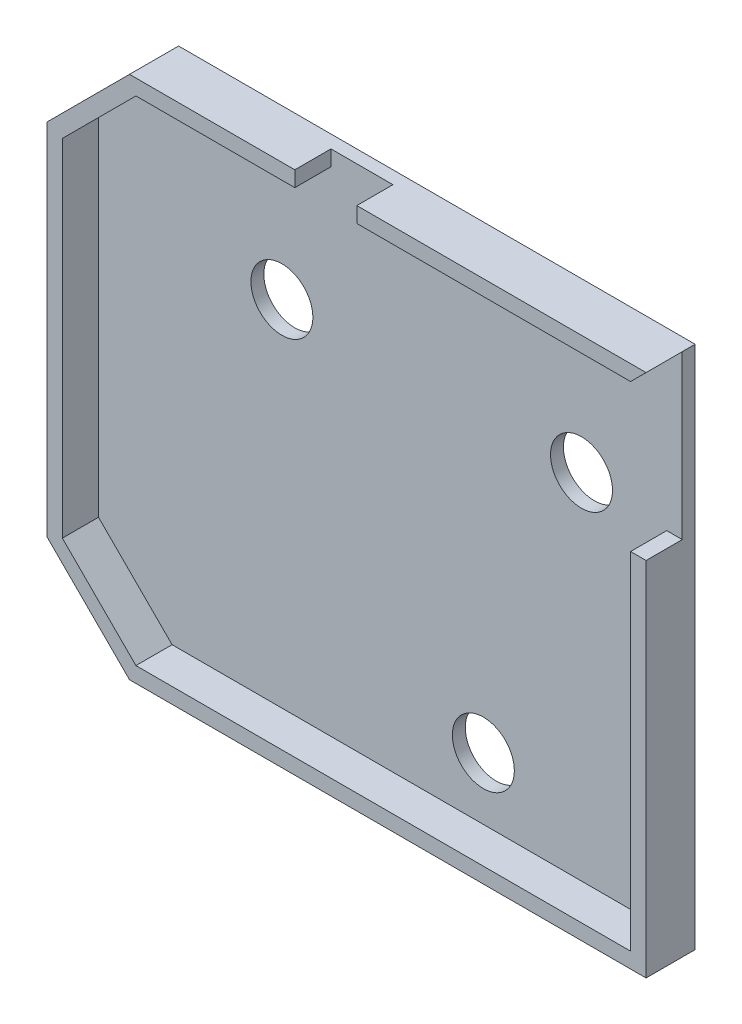
from build123d import *

# Parameters (mm, degrees)
BOSS_EXTRU_1_DEPTH      = 2.5
BOSS_EXTRU_2_DEPTH      = 7
ESQUISSE3_R             = 6
ENL_V_MAT_EXTRU_1_DEPTH = 10


with BuildPart() as part:
    # Esquisse1 → Boss.-Extru.1 (new body)
    with BuildSketch(Plane.XY):
        Polygon((0, -85), (16, -101), (116, -101), (116, 0.5), (16, 0.5), (0, -15.5), align=None)
    extrude(amount=BOSS_EXTRU_1_DEPTH)

    # Esquisse2 → Boss.-Extru.2 (add)
    with BuildSketch(Plane.XY.offset(2.5)):
        Polygon((113, -31), (116, -31), (116, -101), (16, -101), (0, -85), (0, -15.5), (16, 0.5), (48, 0.5), (48, -2.5), (17.242640687, -2.5), (3, -16.742640687), (3, -83.757359313), (17.242640687, -98), (113, -98), align=None)
        Polygon((113, -2.5), (116, 0.5), (60, 0.5), (60, -2.5), align=None)
    extrude(amount=BOSS_EXTRU_2_DEPTH)

    # Esquisse3 → Enlèv. mat.-Extru.1 (cut)
    with BuildSketch(Plane.XY.offset(2.5)):
        with Locations((96.5, -29.5)):
            Circle(ESQUISSE3_R)
        with Locations((38.5, -29.5)):
            Circle(ESQUISSE3_R)
        with Locations((77.5, -86)):
            Circle(ESQUISSE3_R)
    extrude(amount=-ENL_V_MAT_EXTRU_1_DEPTH, mode=Mode.SUBTRACT)


solid = part.part
